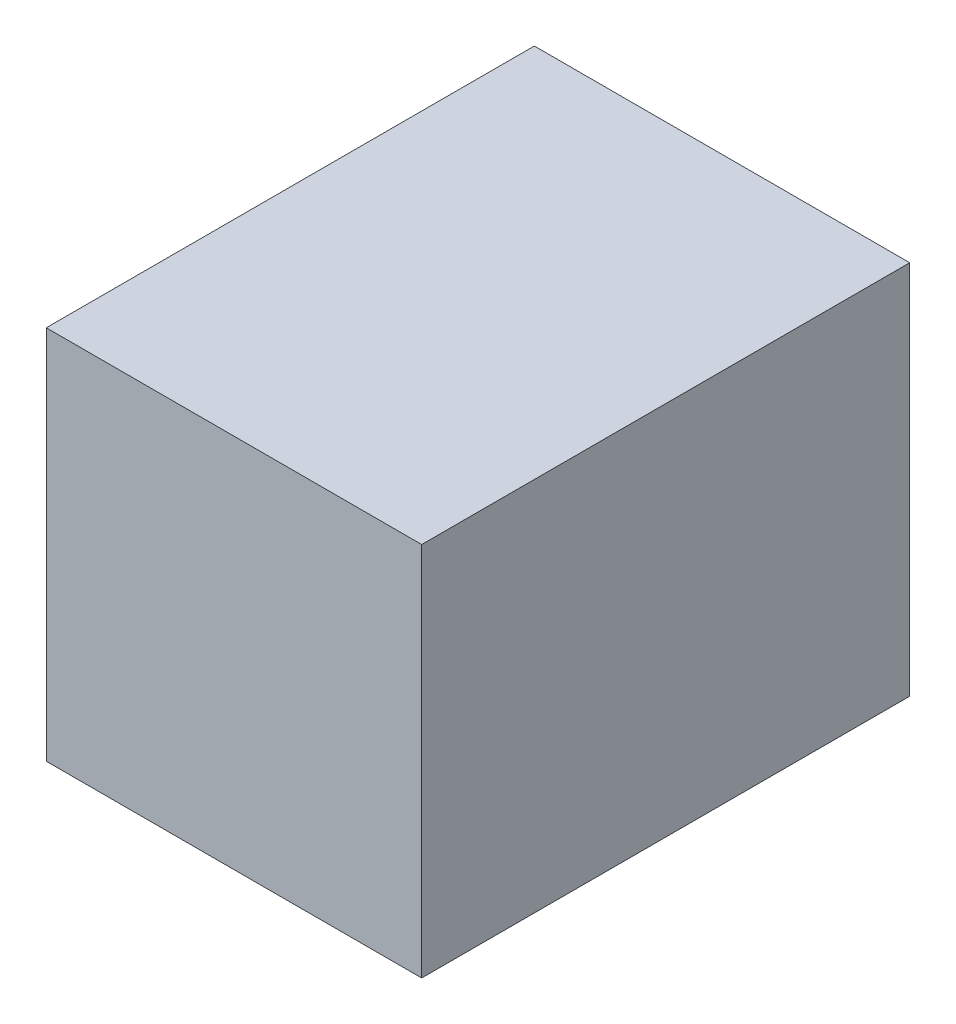
from build123d import *

# Parameters (mm, degrees)
SKETCH1_W           = 10
SKETCH1_H           = 13
BOSS_EXTRUDE1_DEPTH = 10
SKETCH2_W           = 8.5
SKETCH2_H           = 5
CUT_EXTRUDE1_DEPTH  = 7.5
SKETCH3_W           = 3
SKETCH3_H           = 5
CUT_EXTRUDE3_DEPTH  = 10.75
FILLET3_R           = 3
FILLET5_R           = 1.5


with BuildPart() as part:
    # Sketch1 → Boss-Extrude1 (new body)
    with BuildSketch(Plane(origin=(0, 0, 0), x_dir=(1, 0, 0), z_dir=(0, 1, 0))):
        Rectangle(SKETCH1_W, SKETCH1_H)
    extrude(amount=BOSS_EXTRUDE1_DEPTH)

    # Sketch2 → Cut-Extrude1 (cut)
    with BuildSketch(Plane.ZY.offset(5)):
        with Locations((0, 3.9)):
            Rectangle(SKETCH2_W, SKETCH2_H)
    extrude(amount=-CUT_EXTRUDE1_DEPTH, mode=Mode.SUBTRACT)

    # Sketch3 → Cut-Extrude3 (cut)
    with BuildSketch(Plane(origin=(0, 0, -6.5), x_dir=(-1, 0, 0), z_dir=(0, 0, -1))):
        with Locations((-1, 3.9)):
            Rectangle(SKETCH3_W, SKETCH3_H)
    extrude(amount=-CUT_EXTRUDE3_DEPTH, mode=Mode.SUBTRACT)

    # Fillet3
    fillet3_edges = [part.edges().sort_by_distance(p)[0] for p in [
        (-1.25, 6.4, 4.25),
        (-2.75, 6.4, -4.25),
    ]]
    fillet(fillet3_edges, radius=FILLET3_R)

    # Fillet5
    fillet5_edges = [part.edges().sort_by_distance(p)[0] for p in [
        (2.5, 2.4, 4.25),
        (2.5, 5.521320344, 3.371320344),
        (2.5, 6.4, -2.625),
        (-0.5, 6.4, -3.875),
    ]]
    fillet(fillet5_edges, radius=FILLET5_R - 0.0001)  # a hair under: the kernel refuses the full size


solid = part.part
